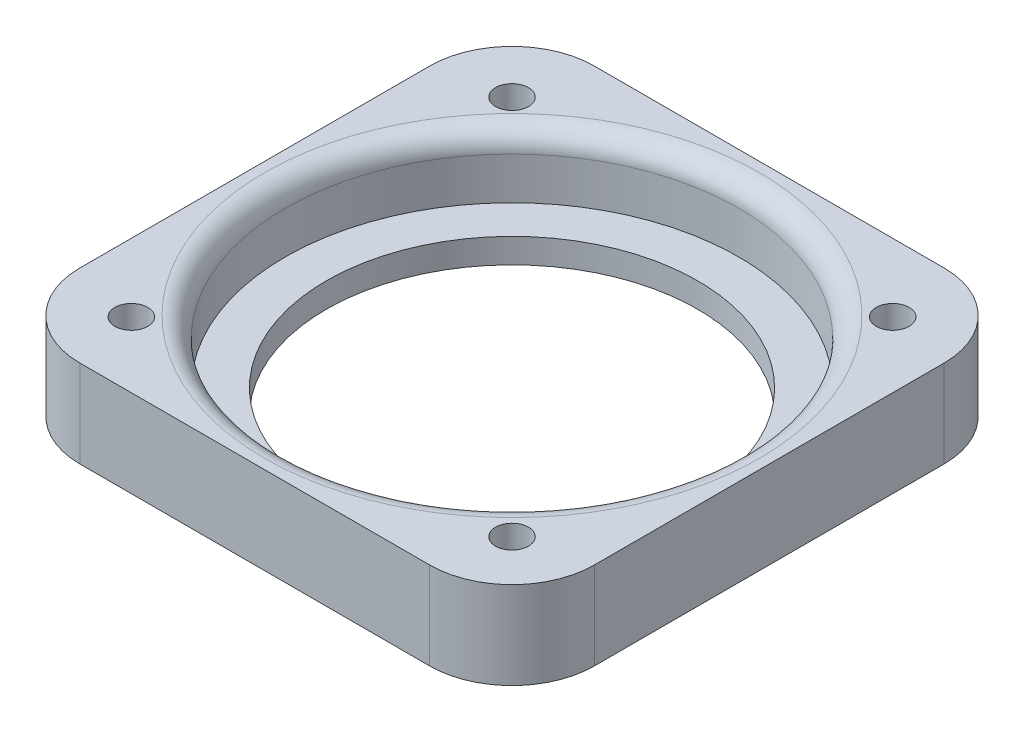
from build123d import *

# Parameters (mm, degrees)
SKETCH_1_R               = 25
EXTRUDE_1_DEPTH          = 8.5
SKETCH_2_R               = 22.05
CUT_EXTRUDE_1_DEPTH      = 6.1
SKETCH_3_R               = 18.05
CUT_EXTRUDE_2_DEPTH      = 12.5
EXTRUDE_2_DEPTH          = 8.5
FILLET_1_R               = 8
SKETCH_5_R               = 1.6
CUT_EXTRUDE_3_DEPTH      = 15
FILLET_2_R               = 2
SKETCH_6_R               = 3.2
CUT_EXTRUDE_4_DEPTH      = 2
PATTERN_CIRCULAR_1_COUNT = 4


with BuildPart() as part:
    # 草图1 → 凸台-拉伸1 (new body)
    with BuildSketch(Plane(origin=(0, 0, 0), x_dir=(1, 0, 0), z_dir=(0, 1, 0))):
        Circle(SKETCH_1_R)
    extrude(amount=EXTRUDE_1_DEPTH)

    # 草图2 → 切除-拉伸1 (cut)
    with BuildSketch(Plane(origin=(0, 8.5, 0), x_dir=(1, 0, 0), z_dir=(0, 1, 0))):
        Circle(SKETCH_2_R)
    extrude(amount=-CUT_EXTRUDE_1_DEPTH, mode=Mode.SUBTRACT)

    # 草图3 → 切除-拉伸2 (cut)
    with BuildSketch(Plane(origin=(0, 2.4, 0), x_dir=(1, 0, 0), z_dir=(0, 1, 0))):
        Circle(SKETCH_3_R)
    extrude(amount=-CUT_EXTRUDE_2_DEPTH, mode=Mode.SUBTRACT)

    # 草图4 → 凸台-拉伸2 (add)
    with BuildSketch(Plane(origin=(0, 0, 0), x_dir=(1, 0, 0), z_dir=(0, 1, 0))):
        with BuildLine():
            Line((0, 25), (-25, 25))
            Line((-25, 25), (-25, 2.6e-08))
            ThreePointArc((-25, 2.6e-08), (-23.301207713, 9.058350794), (-18.435702489, 16.885641052))
            ThreePointArc((-18.435702489, 16.885641052), (-19.445436483, 19.445436483), (-16.885641052, 18.435702489))
            ThreePointArc((-16.885641052, 18.435702489), (-9.058350782, 23.301207718), (0, 25))
        make_face()
        with BuildLine():
            Line((25, 25), (0, 25))
            ThreePointArc((0, 25), (9.210354363, 23.241544108), (17.125028574, 18.213549801))
            ThreePointArc((17.125028574, 18.213549801), (19.682469279, 19.438809921), (18.425448396, 16.896829626))
            ThreePointArc((18.425448396, 16.896829626), (23.298457137, 9.065423048), (25, 0))
            Line((25, 0), (25, 25))
        make_face()
        with BuildLine():
            ThreePointArc((-18.213549801, -17.125028574), (-23.241544113, -9.210354351), (-25, 2.6e-08))
            Line((-25, 2.6e-08), (-25, -25))
            Line((-25, -25), (-5.8e-08, -25))
            ThreePointArc((-5.8e-08, -25), (-9.065423076, -23.298457126), (-16.896829626, -18.425448396))
            ThreePointArc((-16.896829626, -18.425448396), (-19.438809921, -19.682469279), (-18.213549801, -17.125028574))
        make_face()
        with BuildLine():
            Line((25, -25), (25, 0))
            ThreePointArc((25, 0), (23.22561674, -9.250444694), (18.154341838, -17.18778265))
            ThreePointArc((18.154341838, -17.18778265), (19.675883861, -19.675883861), (17.18778265, -18.154341838))
            ThreePointArc((17.18778265, -18.154341838), (9.250444666, -23.225616751), (-5.8e-08, -25))
            Line((-5.8e-08, -25), (25, -25))
        make_face()
    extrude(amount=EXTRUDE_2_DEPTH)

    # 圆角1
    fillet_1_edges = [part.edges().sort_by_distance(p)[0] for p in [
        (-25, 4.25, 25),
        (25, 4.25, 25),
        (25, 4.25, -25),
        (-25, 4.25, -25),
    ]]
    fillet(fillet_1_edges, radius=FILLET_1_R)

    # 草图5 → 切除-拉伸3 (cut)
    with BuildSketch(Plane(origin=(0, 8.5, 0), x_dir=(1, 0, 0), z_dir=(0, 1, 0))):
        with Locations((-18.384776311, 18.384776311)):
            Circle(SKETCH_5_R)
        with Locations((18.615223689, 18.384776311)):
            Circle(SKETCH_5_R)
        with Locations((18.615223689, -18.615223689)):
            Circle(SKETCH_5_R)
        with Locations((-18.384776311, -18.615223689)):
            Circle(SKETCH_5_R)
    extrude(amount=-CUT_EXTRUDE_3_DEPTH, mode=Mode.SUBTRACT)

    # 圆角2
    fillet_2_edges = [part.edges().sort_by_distance(p)[0] for p in [
        (-22.05, 8.5, 0),
    ]]
    fillet(fillet_2_edges, radius=FILLET_2_R)

    # 草图6 → 切除-拉伸4 (cut)
    with BuildSketch(Plane.XZ):
        with Locations((-18.384776311, 18.615223689)):
            Circle(SKETCH_6_R)
    cut_extrude_4 = extrude(amount=-CUT_EXTRUDE_4_DEPTH, mode=Mode.SUBTRACT)

    # 阵列(圆周)1: 切除-拉伸4 ×4 about axis
    pattern_circular_1_axis = Axis((0, 0, 0), (0, 1, 0))
    for i in range(1, PATTERN_CIRCULAR_1_COUNT):
        add(cut_extrude_4.rotate(pattern_circular_1_axis, i * 360 / PATTERN_CIRCULAR_1_COUNT), mode=Mode.SUBTRACT)


solid = part.part
